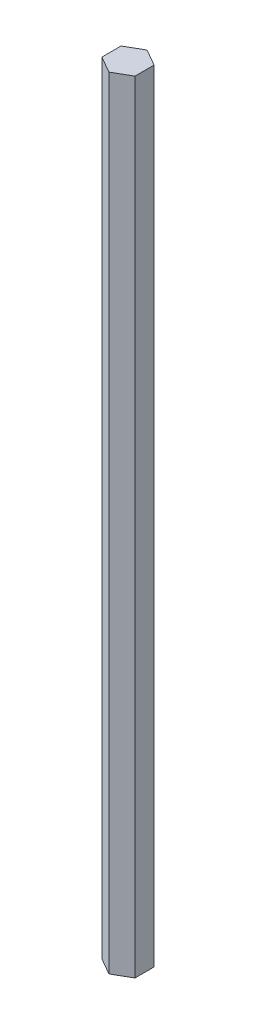
from build123d import *

# Parameters (mm, degrees)
BOSS_EXTRUDE1_DEPTH = 150


with BuildPart() as part:
    # Sketch1 → Boss-Extrude1 (new, symmetric)
    with BuildSketch(Plane(origin=(0, 0, 0), x_dir=(1, 0, 0), z_dir=(0, 1, 0))):
        Polygon((6.349472256, -3.667088137), (6.350527612, 3.665260206), (0.001055356, 7.332348343), (-6.349472256, 3.667088137), (-6.350527612, -3.665260206), (-0.001055356, -7.332348343), align=None)
    extrude(amount=BOSS_EXTRUDE1_DEPTH, both=True)


solid = part.part
